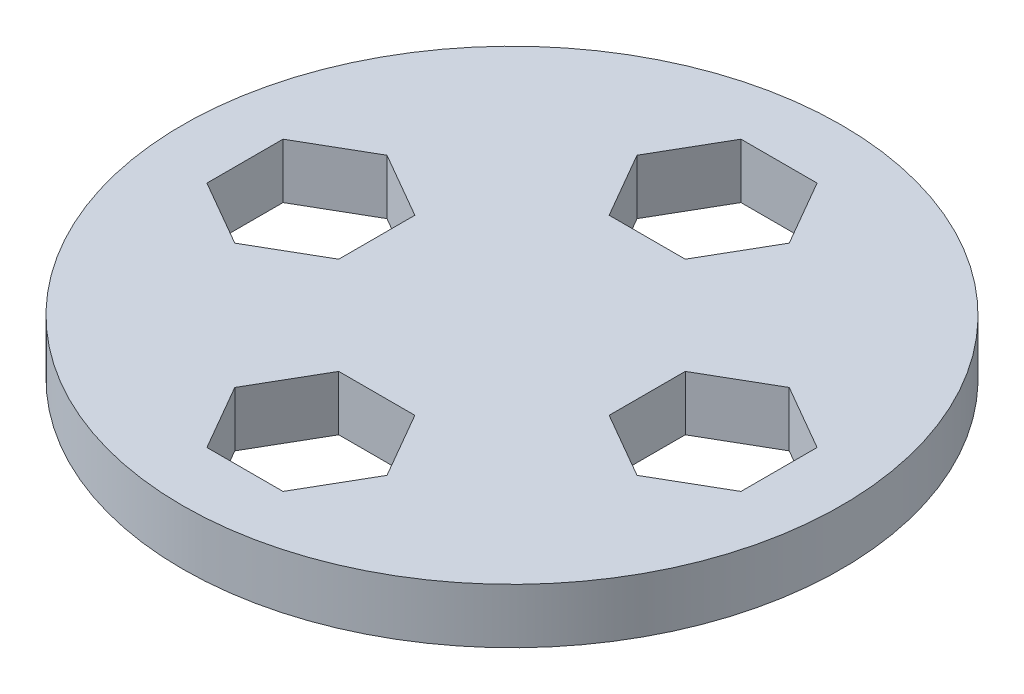
from build123d import *

# Parameters (mm, degrees)
CROQUIS1_R              = 8.5
SALIENTE_EXTRUIR1_DEPTH = 2
CROQUIS2_R              = 7.5
SALIENTE_EXTRUIR2_DEPTH = 4
CROQUIS3_R              = 15
SALIENTE_EXTRUIR3_DEPTH = 2.5
REDONDEO1_R             = 3
CORTAR_EXTRUIR1_DEPTH   = 2.5
CROQUIS5_R              = 8.5
CORTAR_EXTRUIR2_DEPTH   = 10


with BuildPart() as part:
    # Croquis1 → Saliente-Extruir1 (new body)
    with BuildSketch(Plane(origin=(0, 0, 0), x_dir=(1, 0, 0), z_dir=(0, 1, 0))):
        with Locations(Location((0, 0, 0), (0, 0, 270))):
            Circle(CROQUIS1_R)
    extrude(amount=SALIENTE_EXTRUIR1_DEPTH)

    # Croquis2 → Saliente-Extruir2 (add)
    with BuildSketch(Plane(origin=(0, 2, 0), x_dir=(1, 0, 0), z_dir=(0, 1, 0))):
        with Locations(Location((0, 0, 0), (0, 0, 270))):
            Circle(CROQUIS2_R)
    extrude(amount=SALIENTE_EXTRUIR2_DEPTH)

    # Croquis3 → Saliente-Extruir3 (add)
    with BuildSketch(Plane(origin=(0, 6, 0), x_dir=(1, 0, 0), z_dir=(0, 1, 0))):
        with Locations(Location((0, 0, 0), (0, 0, 270))):
            Circle(CROQUIS3_R)
    extrude(amount=SALIENTE_EXTRUIR3_DEPTH)

    # Redondeo1
    # the kernel refuses this fillet: 3 mm, written as the material it takes off along each edge
    with BuildSketch(Plane(origin=(0, 0, 0), x_dir=(0, 0, 1), z_dir=(-1, 0, 0))) as redondeo1_piece_1:
        with BuildLine():
            CenterArc((5.671572875, 3), REDONDEO1_R, 270, 70.528779366)
            Line((5.671572875, 0), (5.671572875, -0.06))
            Line((5.671572875, -0.06), (8.5, -0.06))
            Line((8.5, -0.06), (8.56, 0))
            ThreePointArc((8.56, 0), (8.56, 1), (8.556568542, 1.98))
            Line((8.556568542, 1.98), (8.5, 2))
        make_face()
    revolve(axis=Axis((0, 0, 0), (0, 1, 0)), mode=Mode.SUBTRACT)

    # Croquis4 → Cortar-Extruir1 (cut)
    with BuildSketch(Plane(origin=(0, 8.5, 0), x_dir=(1, 0, 0), z_dir=(0, 1, 0))):
        Polygon((12.154001459, -1.732050808), (12.154001459, 1.732050808), (9.154001459, 3.464101615), (6.154001459, 1.732050808), (6.154001459, -1.732050808), (9.154001459, -3.464101615), align=None)
        Polygon((3.464101615, 9.154001459), (1.732050808, 12.154001459), (-1.732050808, 12.154001459), (-3.464101615, 9.154001459), (-1.732050808, 6.154001459), (1.732050808, 6.154001459), align=None)
        Polygon((-1.732050808, -12.154001459), (1.732050808, -12.154001459), (3.464101615, -9.154001459), (1.732050808, -6.154001459), (-1.732050808, -6.154001459), (-3.464101615, -9.154001459), align=None)
        Polygon((-12.154001459, 1.732050808), (-12.154001459, -1.732050808), (-9.154001459, -3.464101615), (-6.154001459, -1.732050808), (-6.154001459, 1.732050808), (-9.154001459, 3.464101615), align=None)
    extrude(amount=-CORTAR_EXTRUIR1_DEPTH, mode=Mode.SUBTRACT)

    # Croquis5 → Cortar-Extruir2 (cut)
    with BuildSketch(Plane.XZ.offset(-6)):
        Circle(CROQUIS5_R)
    extrude(amount=CORTAR_EXTRUIR2_DEPTH, mode=Mode.SUBTRACT)


solid = part.part
